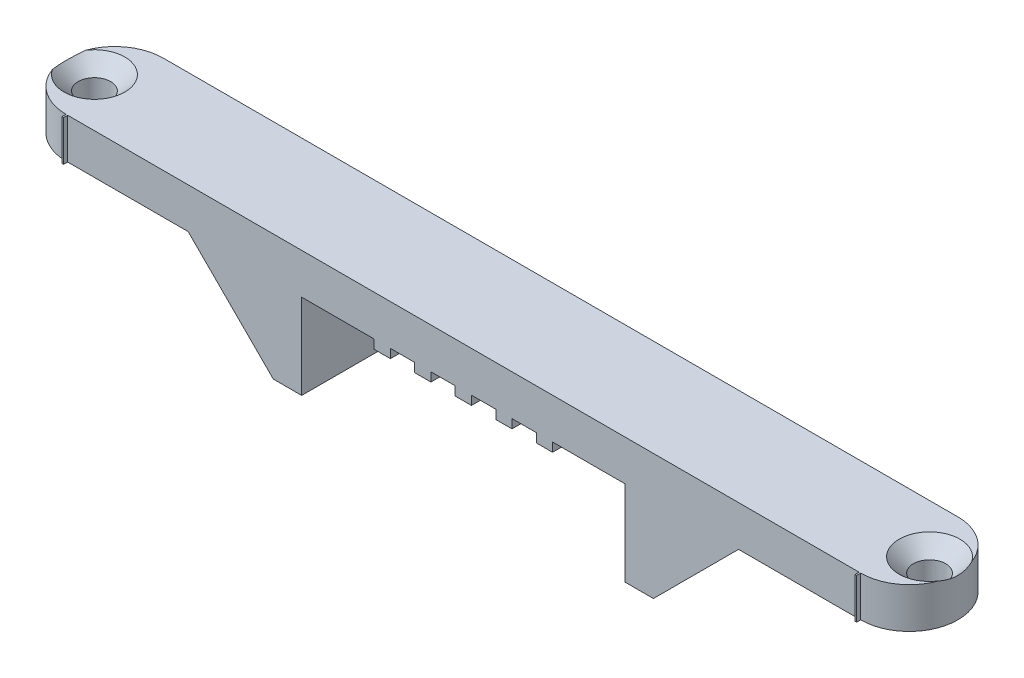
from build123d import *

# Parameters (mm, degrees)
SKETCH1_R                     = 1.5
BOSS_EXTRUDE1_DEPTH           = 3
SKETCH4_W                     = 3.5
SKETCH4_H                     = 12
BOSS_EXTRUDE3_DEPTH           = 10.5
SKETCH5_W                     = 2
SKETCH5_H                     = 12
BOSS_EXTRUDE4_DEPTH           = 1.1
SKETCH6_W                     = 0.2
SKETCH6_H                     = 3
BOSS_EXTRUDE5_DEPTH           = 0.5
CHAMFER1_SIZE                 = 10.5
SKETCH10_R                    = 1.5
BOSS_EXTRUDE6_DEPTH           = 2
CSK_FOR_M4_SFHCS1_D           = 4
CSK_FOR_M4_SFHCS1_DEPTH       = 30.798278762
CSK_FOR_M4_SFHCS1_CSINK_D     = 7.5
CSK_FOR_M4_SFHCS1_CSINK_ANGLE = 90
CSK_FOR_M4_SFHCS1_TIP         = 1.201721238


with BuildPart() as part:
    # Sketch1 → Boss-Extrude1 (new body)
    with BuildSketch(Plane(origin=(0, 0, 0), x_dir=(1, 0, 0), z_dir=(0, 1, 0))):
        with BuildLine():
            Line((-49, 6), (49, 6))
            ThreePointArc((49, 6), (55, 0), (49, -6))
            Line((49, -6), (-49, -6))
            ThreePointArc((-49, -6), (-55, 0), (-49, 6))
        make_face()
        with Locations(Location((-51.5, 0, 0), (0, 0, 270))):
            Circle(SKETCH1_R, mode=Mode.SUBTRACT)
        with Locations(Location((51.5, 0, 0), (0, 0, 270))):
            Circle(SKETCH1_R, mode=Mode.SUBTRACT)
    extrude(amount=BOSS_EXTRUDE1_DEPTH)

    # Sketch4 → Boss-Extrude3 (add)
    with BuildSketch(Plane.XZ):
        with Locations((-21.690023983, 0)):
            Rectangle(SKETCH4_W, SKETCH4_H)
        with Locations((21.690023983, 0)):
            Rectangle(SKETCH4_W, SKETCH4_H)
    extrude(amount=BOSS_EXTRUDE3_DEPTH)

    # Sketch5 → Boss-Extrude4 (add)
    with BuildSketch(Plane.XZ):
        with Locations((5, 0)):
            Rectangle(SKETCH5_W, SKETCH5_H)
        Rectangle(SKETCH5_W, SKETCH5_H)
        with Locations((10, 0)):
            Rectangle(SKETCH5_W, SKETCH5_H)
        with Locations((-5, 0)):
            Rectangle(SKETCH5_W, SKETCH5_H)
        with Locations((-10, 0)):
            Rectangle(SKETCH5_W, SKETCH5_H)
    extrude(amount=BOSS_EXTRUDE4_DEPTH)

    # Sketch6 → Boss-Extrude5 (add)
    with BuildSketch(Plane.XY.offset(6)):
        with Locations((48.9, 1.5)):
            Rectangle(SKETCH6_W, SKETCH6_H)
        with Locations((-48.9, 1.5)):
            Rectangle(SKETCH6_W, SKETCH6_H)
    extrude(amount=BOSS_EXTRUDE5_DEPTH)

    # Chamfer1
    chamfer1_edges = [part.edges().sort_by_distance(p)[0] for p in [
        (-23.440023983, 0, 0),
        (23.440023983, 0, 0),
    ]]
    chamfer(chamfer1_edges, length=CHAMFER1_SIZE - 0.0001)  # a hair under: the kernel refuses the full size

    # Sketch10 → Boss-Extrude6 (add)
    with BuildSketch(Plane(origin=(0, 3, 0), x_dir=(1, 0, 0), z_dir=(0, 1, 0))):
        with BuildLine():
            Line((-49, -6), (-49, -6.5))
            Line((-49, -6.5), (-48.8, -6.5))
            Line((-48.8, -6.5), (-48.8, -6))
            Line((-48.8, -6), (48.8, -6))
            Line((48.8, -6), (48.8, -6.5))
            Line((48.8, -6.5), (49, -6.5))
            Line((49, -6.5), (49, -6))
            ThreePointArc((49, -6), (55, 0), (49, 6))
            Line((49, 6), (-49, 6))
            ThreePointArc((-49, 6), (-55, 0), (-49, -6))
        make_face()
        with Locations(Location((-51.5, 0, 0), (0, 0, 270))):
            Circle(SKETCH10_R, mode=Mode.SUBTRACT)
        with Locations(Location((51.5, 0, 0), (0, 0, 270))):
            Circle(SKETCH10_R, mode=Mode.SUBTRACT)
    extrude(amount=BOSS_EXTRUDE6_DEPTH)

    # CSK for M4 SFHCS1
    with Locations(Plane(origin=(0, 5, 0), x_dir=(1, 0, 0), z_dir=(0, 1, 0))):
        with Locations((51.5, 0), (-51.5, 0)):
            CounterSinkHole(CSK_FOR_M4_SFHCS1_D / 2, CSK_FOR_M4_SFHCS1_CSINK_D / 2, depth=CSK_FOR_M4_SFHCS1_DEPTH, counter_sink_angle=CSK_FOR_M4_SFHCS1_CSINK_ANGLE)
            with Locations((0, 0, -(CSK_FOR_M4_SFHCS1_DEPTH + CSK_FOR_M4_SFHCS1_TIP / 2))):  # 118° drill point
                Cone(0, CSK_FOR_M4_SFHCS1_D / 2, CSK_FOR_M4_SFHCS1_TIP, mode=Mode.SUBTRACT)


solid = part.part
